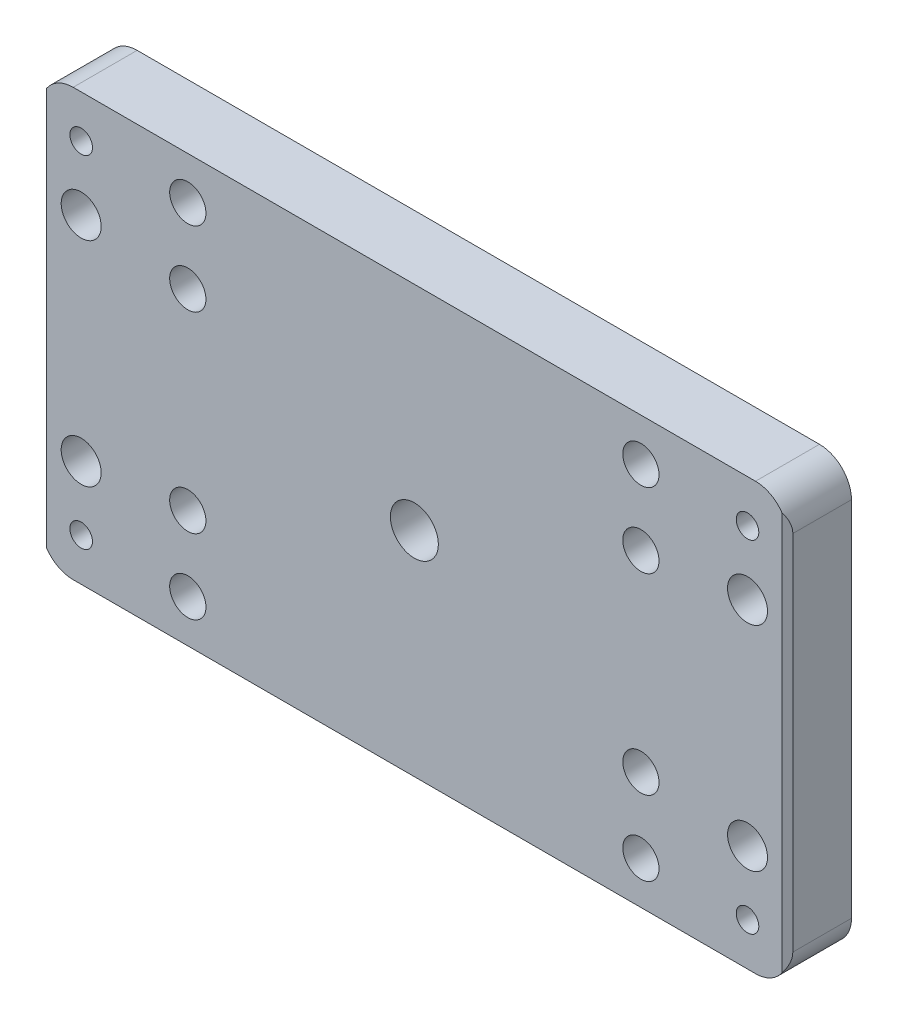
from build123d import *

# Parameters (mm, degrees)
SKETCH1_W           = 140
SKETCH1_H           = 80
SKETCH1_R           = 2.117
SKETCH1_R_2         = 3.75
SKETCH1_R_3         = 4.5
BOSS_EXTRUDE1_DEPTH = 12
SKETCH2_R           = 3.4
CUT_EXTRUDE1_DEPTH  = 82.510735489
FILLET1_R           = 6


with BuildPart() as part:
    # Sketch1 → Boss-Extrude1 (new body)
    with BuildSketch(Plane.XY):
        Rectangle(SKETCH1_W, SKETCH1_H)
        with Locations((-62.499963671, 32)):
            Circle(SKETCH1_R, mode=Mode.SUBTRACT)
        with Locations((-62.500002371, 20.00021325)):
            Circle(SKETCH1_R_2, mode=Mode.SUBTRACT)
        with Locations((-62.499963671, -32)):
            Circle(SKETCH1_R, mode=Mode.SUBTRACT)
        with Locations((-62.500002371, -19.99978675)):
            Circle(SKETCH1_R_2, mode=Mode.SUBTRACT)
        Circle(SKETCH1_R_3, mode=Mode.SUBTRACT)
        with Locations((62.499963671, 32)):
            Circle(SKETCH1_R, mode=Mode.SUBTRACT)
        with Locations((62.499997629, 20.00021325)):
            Circle(SKETCH1_R_2, mode=Mode.SUBTRACT)
        with Locations((62.499997629, -19.99978675)):
            Circle(SKETCH1_R_2, mode=Mode.SUBTRACT)
        with Locations((62.499963671, -32)):
            Circle(SKETCH1_R, mode=Mode.SUBTRACT)
    extrude(amount=BOSS_EXTRUDE1_DEPTH)

    # Sketch2 → Cut-Extrude1 (cut, through all)
    with BuildSketch(Plane.XY.offset(12)):
        with Locations((42.499997629, 32)):
            Circle(SKETCH2_R)
        with Locations((-42.500002371, 32)):
            Circle(SKETCH2_R)
        with Locations((-42.500002371, 18)):
            Circle(SKETCH2_R)
        with Locations((42.499997629, 18)):
            Circle(SKETCH2_R)
        with Locations((42.499997629, -18)):
            Circle(SKETCH2_R)
        with Locations((42.499997629, -32)):
            Circle(SKETCH2_R)
        with Locations((-42.500002371, -32)):
            Circle(SKETCH2_R)
        with Locations((-42.500002371, -18)):
            Circle(SKETCH2_R)
    extrude(amount=-CUT_EXTRUDE1_DEPTH, mode=Mode.SUBTRACT)

    # Fillet1
    fillet1_edges = [part.edges().sort_by_distance(p)[0] for p in [
        (70, -40, 6),
        (-70, -40, 6),
        (-70, 40, 6),
        (70, 40, 6),
    ]]
    fillet(fillet1_edges, radius=FILLET1_R)

    # Chamfer1
    # the kernel refuses this chamfer: 1 mm, written as the material it takes off along each edge
    with BuildSketch(Plane(origin=(-70, 40.172039171, 12), x_dir=(0.9996219169112968, 0, 0.02749587661058574), z_dir=(0, -1, 0)), Plane(origin=(70, -40.172039171, 12), x_dir=(-0.9996219169112968, 0, 0.02749587661058574), z_dir=(0, 1, 0))) as chamfer1_piece_1:
        with BuildLine():
            Line((1.028673195, 0), (-0.056547155, -1.027117794))
            Line((-0.056547155, -1.027117794), (-0.076539593, -1.026567876))
            ThreePointArc((-0.076539593, -1.026567876), (-0.034129227, -0.51339783), (-0.019992438, 0.000549918))
            Line((-0.019992438, 0.000549918), (0.000549918, 0.019992438))
            ThreePointArc((0.000549918, 0.019992438), (0.514497665, 0.00585565), (1.029223113, 0.019992438))
            Line((1.029223113, 0.019992438), (1.028673195, 0))
        make_face()
    extrude(amount=80.344078342, mode=Mode.SUBTRACT)


solid = part.part
